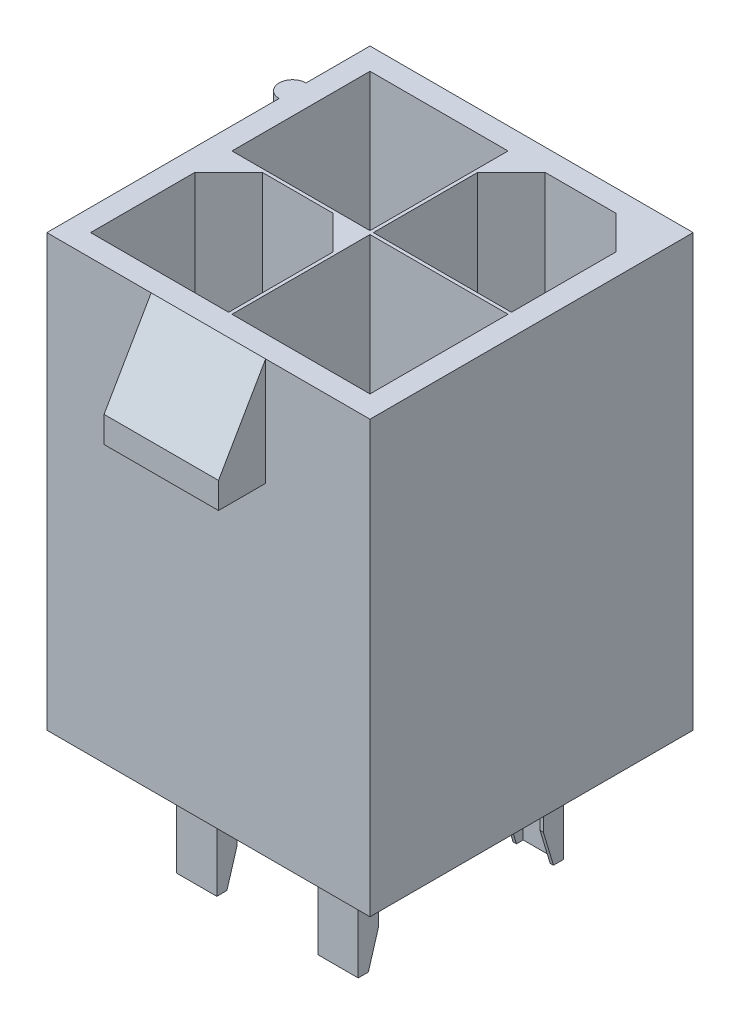
from build123d import *

# Parameters (mm, degrees)
HOUSING_DEPTH                      = 12.8
CUT_EXTRUDE_3_DEPTH                = 9.3
SKETCH_3_W                         = 4.1
SKETCH_3_H                         = 4.1
CUT_EXTRUDE_4_DEPTH                = 9.3
PATTERN_LINEAR_1_COUNT             = 2
PATTERN_LINEAR_1_PITCH             = 4.2
PATTERN_LINEAR_1_COUNT_DIR2        = 2
PATTERN_LINEAR_1_PITCH_DIR2        = 4.2
PATTERN_LINEAR_2_COUNT             = 2
PATTERN_LINEAR_2_PITCH             = 4.2
PATTERN_LINEAR_2_COUNT_DIR2        = 2
PATTERN_LINEAR_2_PITCH_DIR2        = 4.2
SKETCH_4_W                         = 1
SKETCH_4_H                         = 1
EXTRUDE_2286_DEPTH                 = 6
CHAMFER_1_SIZE                     = 0.5
PATTERN_LINEAR_3_COUNT             = 2
PATTERN_LINEAR_3_PITCH             = 4.2
CHAMFER_1_OF_PATTERN_LINEAR_3_SIZE = 0.5
EXTRUDE_START                      = -3.1
EXTRUDE_3473_DEPTH                 = 3.4
EXTRUDE_3845_DEPTH                 = 3.5
CUT_EXTRUDE_5_DEPTH                = 1.25
PATTERN_LINEAR_4_COUNT             = 2
PATTERN_LINEAR_4_PITCH             = 4.2


with BuildPart() as part:
    # Эскиз1 → Housing (new body)
    with BuildSketch(Plane(origin=(0, 0, 0), x_dir=(1, 0, 0), z_dir=(0, 1, 0))):
        with BuildLine():
            Line((-2.7, 4.2), (-2.7, -2.7))
            Line((-2.7, -2.7), (6.9, -2.7))
            Line((6.9, -2.7), (6.9, 6.9))
            Line((6.9, 6.9), (-2.7, 6.9))
            Line((-2.7, 6.9), (-2.7, 5))
            ThreePointArc((-2.7, 5), (-3.1, 4.6), (-2.7, 4.2))
        make_face()
    extrude(amount=HOUSING_DEPTH)

    # Эскиз2 → Вырез-Вытянуть3 (cut)
    with BuildSketch(Plane(origin=(0, 12.8, 0), x_dir=(1, 0, 0), z_dir=(0, 1, 0))):
        Polygon((-2.05, -2.05), (-2.05, 1.05), (-1.05, 2.05), (1.05, 2.05), (2.05, 1.05), (2.05, -2.05), align=None)
    cut_extrude_3 = extrude(amount=-CUT_EXTRUDE_3_DEPTH, mode=Mode.SUBTRACT)

    # Эскиз3 → Вырез-Вытянуть4 (cut)
    with BuildSketch(Plane(origin=(0, 12.8, 0), x_dir=(1, 0, 0), z_dir=(0, 1, 0))):
        with Locations((0, 4.2)):
            Rectangle(SKETCH_3_W, SKETCH_3_H)
    cut_extrude_4 = extrude(amount=-CUT_EXTRUDE_4_DEPTH, mode=Mode.SUBTRACT)

    # Линейный массив1: Cut-Extrude 4 2 × 2, 2 skipped
    with Locations(*[(i * PATTERN_LINEAR_1_PITCH, 0, j * PATTERN_LINEAR_1_PITCH_DIR2) for i in range(PATTERN_LINEAR_1_COUNT) for j in range(PATTERN_LINEAR_1_COUNT_DIR2) if (i, j) not in ((0, 0), (0, 1), (1, 0))]):
        add(cut_extrude_4, mode=Mode.SUBTRACT)

    # Линейный массив2: Cut-Extrude 3 2 × 2, 2 skipped
    with Locations(*[(i * PATTERN_LINEAR_2_PITCH, 0, -j * PATTERN_LINEAR_2_PITCH_DIR2) for i in range(PATTERN_LINEAR_2_COUNT) for j in range(PATTERN_LINEAR_2_COUNT_DIR2) if (i, j) not in ((0, 0), (0, 1), (1, 0))]):
        add(cut_extrude_3, mode=Mode.SUBTRACT)

    # Эскиз4 → Extrude 2286 (add)
    with BuildSketch(Plane(origin=(0, 3.5, 0), x_dir=(1, 0, 0), z_dir=(0, 1, 0))):
        Rectangle(SKETCH_4_W, SKETCH_4_H)
        with Locations((0, 4.2)):
            Rectangle(SKETCH_4_W, SKETCH_4_H)
    extrude_2286 = extrude(amount=EXTRUDE_2286_DEPTH)

    # Фаска1
    chamfer_1_edges = [part.edges().sort_by_distance(p)[0] for p in [
        (0.5, 9.5, 0),
        (0, 9.5, -0.5),
        (-0.5, 9.5, 0),
        (0, 9.5, 0.5),
        (0.5, 9.5, -4.2),
        (0, 9.5, -4.7),
        (-0.5, 9.5, -4.2),
        (0, 9.5, -3.7),
    ]]
    chamfer(chamfer_1_edges, length=CHAMFER_1_SIZE - 0.0001)  # a hair under: the kernel refuses the full size

    # Линейный массив3: Extrude 2286 ×2
    with Locations(*[(i * PATTERN_LINEAR_3_PITCH, 0, 0) for i in range(1, PATTERN_LINEAR_3_COUNT)]):
        add(extrude_2286)

    # Фаска1 of Линейный массив3
    chamfer_1_of_pattern_linear_3_edges = [part.edges().sort_by_distance(p)[0] for p in [
        (4.7, 9.5, 0),
        (4.2, 9.5, -0.5),
        (3.7, 9.5, 0),
        (4.2, 9.5, 0.5),
        (4.7, 9.5, -4.2),
        (4.2, 9.5, -4.7),
        (3.7, 9.5, -4.2),
        (4.2, 9.5, -3.7),
    ]]
    chamfer(chamfer_1_of_pattern_linear_3_edges, length=CHAMFER_1_OF_PATTERN_LINEAR_3_SIZE - 0.0001)  # a hair under: the kernel refuses the full size

    # Эскиз5 → Extrude 3473 (add)
    with BuildSketch(Plane.ZY.offset(2.7).offset(EXTRUDE_START)):
        Polygon((2.7, 9.6), (2.7, 12.8), (4.1, 10.375128869), (4.1, 9.6), align=None)
    extrude(amount=-EXTRUDE_3473_DEPTH)

    # Эскиз6 → Extrude 3845 (add)
    with BuildSketch(Plane.XZ):
        Polygon((-0.6, -4.55), (-0.6, -5.15), (0.6, -5.15), (0.6, -4.55), (0.5, -4.55), (0.5, -5.05), (-0.5, -5.05), (-0.5, -4.55), align=None)
        Polygon((-0.5, 0.35), (-0.6, 0.35), (-0.6, 0.95), (0.6, 0.95), (0.6, 0.35), (0.5, 0.35), (0.5, 0.85), (-0.5, 0.85), align=None)
    extrude_3845 = extrude(amount=EXTRUDE_3845_DEPTH)

    # Эскиз7 → Вырез-Вытянуть5 (cut)
    with BuildSketch(Plane(origin=(0.6, 0, 0), x_dir=(0, 0, -1), z_dir=(1, 0, 0))):
        Polygon((-0.65, -3.5), (-0.35, -2.5), (4.55, -2.5), (4.85, -3.5), align=None)
    cut_extrude_5 = extrude(amount=-CUT_EXTRUDE_5_DEPTH, mode=Mode.SUBTRACT)

    # Линейный массив4: Extrude 3845, Вырез-Вытянуть5 ×2
    with Locations(*[(i * PATTERN_LINEAR_4_PITCH, 0, 0) for i in range(1, PATTERN_LINEAR_4_COUNT)]):
        add(extrude_3845)
        add(cut_extrude_5, mode=Mode.SUBTRACT)


solid = part.part
